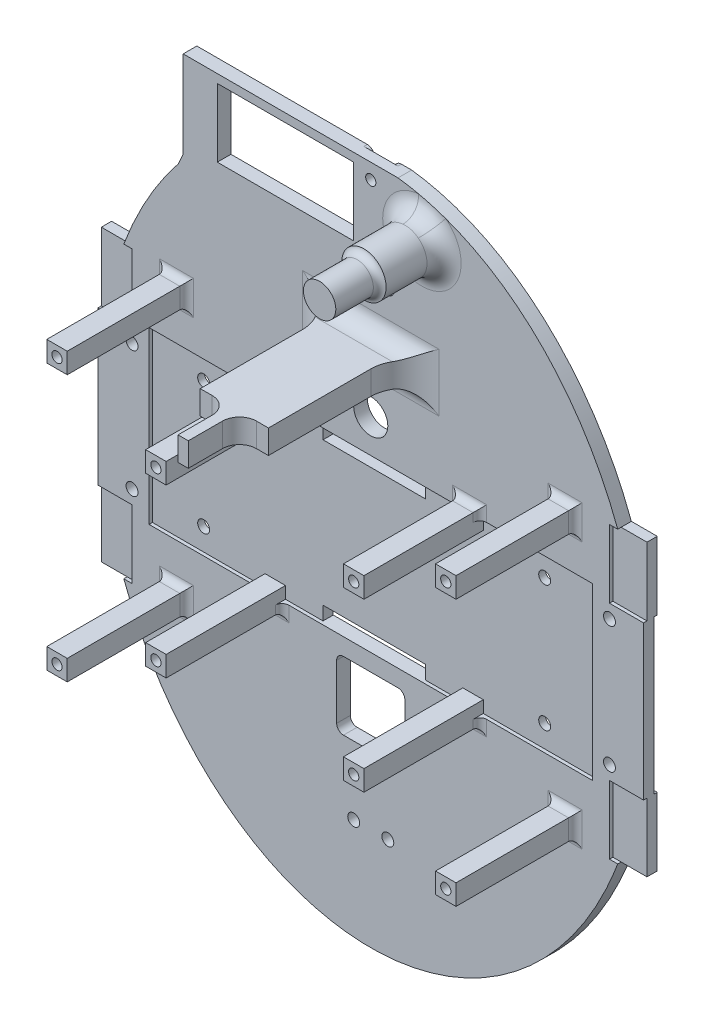
from build123d import *

# Parameters (mm, degrees)
ESQUISSE1_RX             = 100
ESQUISSE1_RY             = 80
BOSS_EXTRU_1_DEPTH       = 4
ESQUISSE2_W              = 40
ESQUISSE2_H              = 45
BOSS_EXTRU_2_DEPTH       = 4
ENL_V_MAT_EXTRU_1_DEPTH  = 1
ESQUISSE4_W              = 20
ESQUISSE4_H              = 20
ENL_V_MAT_EXTRU_2_DEPTH  = 129.124939168
CONG_1_R                 = 2
BOSS_EXTRU_4_START       = -4
BOSS_EXTRU_4_OUTLINE_W   = 40
BOSS_EXTRU_4_OUTLINE_H   = 45
BOSS_EXTRU_4_DEPTH       = 4
ESQUISSE6_W              = 40
ESQUISSE6_H              = 20
ENL_V_MAT_EXTRU_3_DEPTH  = 129.124939168
ESQUISSE7_R              = 6.5
BOSS_EXTRU_5_DEPTH       = 17
CONG_3_R                 = 5
ESQUISSE8_R              = 4.75
BOSS_EXTRU_6_DEPTH       = 13
CONG_4_R                 = 2
ESQUISSE9_W              = 50
ESQUISSE9_H              = 50
ESQUISSE9_R              = 2.5
ENL_V_MAT_EXTRU_5_DEPTH  = 1
ESQUISSE10_W             = 130
ESQUISSE10_H             = 50
ENL_V_MAT_EXTRU_6_DEPTH  = 1
ESQUISSE12_R             = 1.75
ENL_V_MAT_EXTRU_8_DEPTH  = 133.499056736
ESQUISSE13_W             = 20
ESQUISSE13_H             = 7
BOSS_EXTRU_7_DEPTH       = 40
CONG_5_R                 = 10
CONG_6_R                 = 5
ESQUISSE14_W             = 3
ESQUISSE14_H             = 7
BOSS_EXTRU_8_DEPTH       = 15
CONG_7_R                 = 5
BOSS_EXTRU_9_DEPTH       = 4
ESQUISSE16_R             = 5
ENL_V_MAT_EXTRU_9_DEPTH  = 140.373598719
ESQUISSE17_W             = 10
ESQUISSE17_H             = 20
ENL_V_MAT_EXTRU_10_DEPTH = 1
ESQUISSE27_W             = 40
ESQUISSE27_H             = 45
ENL_V_MAT_EXTRU_18_DEPTH = 1
ENL_V_START              = 50
ESQUISSE18_R             = 1.75
ENL_V_MAT_EXTRU_11_DEPTH = 191.584494237
ESQUISSE19_W             = 30
ESQUISSE19_H             = 4
ENL_V_MAT_EXTRU_12_DEPTH = 140.771241749
BOSS_EXTRU_10_START      = -1
ESQUISSE20_W             = 6
ESQUISSE20_H             = 6
ESQUISSE20_R             = 1.5
BOSS_EXTRU_10_DEPTH      = 35
ESQUISSE21_R             = 1.5
ENL_V_MAT_EXTRU_13_DEPTH = 5
CONG_8_R                 = 2
ESQUISSE20_3_W           = 6
ESQUISSE20_3_H           = 6
ESQUISSE20_3_R           = 1.5
BOSS_EXTRU_11_DEPTH      = 35
ESQUISSE22_R             = 1.5
ENL_V_MAT_EXTRU_14_DEPTH = 5
CONG_9_R                 = 2
ENL_V_START_2            = -3
ESQUISSE23_W             = 6
ESQUISSE23_H             = 8
ENL_V_MAT_EXTRU_15_DEPTH = 1
ESQUISSE24_R             = 1.5
ENL_V_MAT_EXTRU_16_DEPTH = 140.373598719
ENL_V_MAT_EXTRU_17_DEPTH = 140.373598719
CONG_12_R                = 2


# Read off the part's stored shape, not the designer's step: Boss.-Extru.4
with BuildPart() as part:
    # Esquisse1 → Boss.-Extru.1 (new body)
    with BuildSketch(Plane.XY):
        with Locations(Location((0, 0), (0, 0, -90))):
            Ellipse(ESQUISSE1_RX, ESQUISSE1_RY)
    extrude(amount=BOSS_EXTRU_1_DEPTH)

    # Esquisse2 → Boss.-Extru.2 (add)
    with BuildSketch(Plane(origin=(0, 0, 0), x_dir=(-1, 0, 0), z_dir=(0, 0, -1))):
        with Locations((-60, 0)):
            Rectangle(ESQUISSE2_W, ESQUISSE2_H)
        with Locations((60, 0)):
            Rectangle(ESQUISSE2_W, ESQUISSE2_H)
    extrude(amount=-BOSS_EXTRU_2_DEPTH)

    # Esquisse3 → Enlèv. mat.-Extru.1 (cut)
    with BuildSketch(Plane(origin=(0, 0, 0), x_dir=(-1, 0, 0), z_dir=(0, 0, -1))):
        Polygon((-77.94870108, 22.5), (-80, 22.5), (-80, -22.5), (-77.94870108, -22.5), (-40, -22.5), (-40, 22.5), align=None)
        Polygon((77.94870108, 22.5), (40, 22.5), (40, -22.5), (77.94870108, -22.5), (80, -22.5), (80, 22.5), align=None)
    extrude(amount=-ENL_V_MAT_EXTRU_1_DEPTH, mode=Mode.SUBTRACT)

    # Esquisse4 → Enlèv. mat.-Extru.2 (cut, through all)
    with BuildSketch(Plane(origin=(0, 0, 0), x_dir=(-1, 0, 0), z_dir=(0, 0, -1))):
        with Locations((0, -40)):
            Rectangle(ESQUISSE4_W, ESQUISSE4_H)
    extrude(amount=-ENL_V_MAT_EXTRU_2_DEPTH, mode=Mode.SUBTRACT)

    # Congé1
    cong_1_edges = [part.edges().sort_by_distance(p)[0] for p in [
        (-10, -50, 2),
        (10, -50, 2),
        (10, -30, 2),
        (-10, -30, 2),
    ]]
    fillet(cong_1_edges, radius=CONG_1_R)

    # Boss.-Extru.4 outline → Boss.-Extru.4 (add)
    with BuildSketch(Plane.XY.offset(4).offset(BOSS_EXTRU_4_START)):
        with Locations((60, 0)):
            Rectangle(BOSS_EXTRU_4_OUTLINE_W, BOSS_EXTRU_4_OUTLINE_H)
        with Locations((-60, 0)):
            Rectangle(BOSS_EXTRU_4_OUTLINE_W, BOSS_EXTRU_4_OUTLINE_H)
        with BuildLine():
            add(Edge.make_bspline(
                [(-7.989993742, 99.5), (-13.792084078, 98.772005881), (-19.44839325, 97)],
                knots=[3.24781181, 3.24781181, 3.24781181, 3.39699249, 3.39699249, 3.39699249], degree=2, weights=[0.968352937, 0.948036722, 0.933078023]))
            Line((-7.989993742, 99.5), (-55, 99.5))
            Line((-55, 99.5), (-55, 74))
            Line((-55, 74), (-56.337661304, 70.998106475))
            add(Edge.make_bspline(
                [(-45, 82.679728471), (-51.099739487, 77.492387624), (-56.337661304, 70.998106475)],
                knots=[3.741790933, 3.741790933, 3.741790933, 3.918875467, 3.918875467, 3.918875467], degree=2, weights=[0.892550465, 0.889492659, 0.89398403]))
            Line((-45, 82.679728471), (-45, 97))
            Line((-45, 97), (-19.44839325, 97))
        make_face()
    extrude(amount=BOSS_EXTRU_4_DEPTH)

    # Esquisse6 → Enlèv. mat.-Extru.3 (cut, through all)
    with BuildSketch(Plane.XY.offset(4)):
        with Locations((-25, 87)):
            Rectangle(ESQUISSE6_W, ESQUISSE6_H)
    extrude(amount=-ENL_V_MAT_EXTRU_3_DEPTH, mode=Mode.SUBTRACT)

    # Esquisse7 → Boss.-Extru.5 (add)
    with BuildSketch(Plane.XY.offset(4)):
        with Locations((15, 87)):
            Circle(ESQUISSE7_R)
    extrude(amount=BOSS_EXTRU_5_DEPTH)

    # Congé3
    cong_3_edges = [part.edges().sort_by_distance(p)[0] for p in [
        (8.5, 87, 4),
    ]]
    fillet(cong_3_edges, radius=CONG_3_R)

    # Esquisse8 → Boss.-Extru.6 (add)
    with BuildSketch(Plane.XY.offset(21)):
        with Locations(Location((15, 87, 0), (0, 0, 180))):
            Circle(ESQUISSE8_R)
    extrude(amount=BOSS_EXTRU_6_DEPTH)

    # Congé4
    # the kernel refuses this fillet: 2 mm, written as the material it adds along each edge
    with BuildSketch(Plane(origin=(15, 87, 21), x_dir=(-1, 0, 0), z_dir=(0, 1, 0))) as cong_4_piece_1:
        with BuildLine():
            CenterArc((6.75, 1.984313483), CONG_4_R, 180, 82.819244219)
            Line((4.75, 1.984313483), (4.71, 1.984313483))
            Line((4.71, 1.984313483), (4.71, 0))
            Line((4.71, 0), (4.75, -0.04))
            ThreePointArc((4.75, -0.04), (5.625, -0.04), (6.495, -0.03968627))
            Line((6.495, -0.03968627), (6.5, 0))
        make_face()
    revolve(axis=Axis((15, 87, 21), (0, 0, 1)))

    # Esquisse9 → Enlèv. mat.-Extru.5 (cut)
    with BuildSketch(Plane.XY.offset(4)):
        Rectangle(ESQUISSE9_W, ESQUISSE9_H)
        with Locations((-17, 17)):
            Circle(ESQUISSE9_R, mode=Mode.SUBTRACT)
        with Locations((17, 17)):
            Circle(ESQUISSE9_R, mode=Mode.SUBTRACT)
        with Locations((17, -17)):
            Circle(ESQUISSE9_R, mode=Mode.SUBTRACT)
        with Locations((-17, -17)):
            Circle(ESQUISSE9_R, mode=Mode.SUBTRACT)
    extrude(amount=-ENL_V_MAT_EXTRU_5_DEPTH, mode=Mode.SUBTRACT)

    # Esquisse10 → Enlèv. mat.-Extru.6 (cut)
    with BuildSketch(Plane.XY.offset(4)):
        Rectangle(ESQUISSE10_W, ESQUISSE10_H)
    extrude(amount=-ENL_V_MAT_EXTRU_6_DEPTH, mode=Mode.SUBTRACT)

    # Esquisse12 → Enlèv. mat.-Extru.8 (cut, through all)
    with BuildSketch(Plane(origin=(0, 0, 0), x_dir=(-1, 0, 0), z_dir=(0, 0, -1))):
        with Locations((-5, 70)):
            Circle(ESQUISSE12_R)
        with Locations((5, 70)):
            Circle(ESQUISSE12_R)
        with Locations((-5, -70)):
            Circle(ESQUISSE12_R)
        with Locations((5, -70)):
            Circle(ESQUISSE12_R)
    extrude(amount=-ENL_V_MAT_EXTRU_8_DEPTH, mode=Mode.SUBTRACT)

    # Esquisse13 → Boss.-Extru.7 (add)
    with BuildSketch(Plane.XY.offset(4)):
        with Locations((0, 53.5)):
            Rectangle(ESQUISSE13_W, ESQUISSE13_H)
    extrude(amount=BOSS_EXTRU_7_DEPTH)

    # Congé5
    cong_5_edges = [part.edges().sort_by_distance(p)[0] for p in [
        (-10, 53.5, 4),
        (10, 53.5, 4),
    ]]
    fillet(cong_5_edges, radius=CONG_5_R)

    # Congé6
    cong_6_edges = [part.edges().sort_by_distance(p)[0] for p in [
        (0, 50, 4),
        (0, 57, 4),
    ]]
    fillet(cong_6_edges, radius=CONG_6_R)

    # Esquisse14 → Boss.-Extru.8 (add)
    with BuildSketch(Plane.XY.offset(44)):
        with Locations((0, 53.5)):
            Rectangle(ESQUISSE14_W, ESQUISSE14_H)
    extrude(amount=BOSS_EXTRU_8_DEPTH)

    # Congé7
    cong_7_edges = [part.edges().sort_by_distance(p)[0] for p in [
        (-1.5, 53.5, 44),
        (1.5, 53.5, 44),
    ]]
    fillet(cong_7_edges, radius=CONG_7_R)

    # Esquisse15 → Boss.-Extru.9 (add)
    with BuildSketch(Plane.XY.offset(4)):
        with BuildLine():
            Line((-80, 42.5), (-80, 22.5))
            Line((-80, 22.5), (-77.94870108, 22.5))
            add(Edge.make_bspline(
                [(-72.415467961, 42.5), (-76.033351154, 32.867988807), (-77.94870108, 22.5)],
                knots=[4.272997494, 4.272997494, 4.272997494, 4.485445944, 4.485445944, 4.485445944], degree=2, weights=[0.981528774, 0.98515969, 1]))
            Line((-72.415467961, 42.5), (-80, 42.5))
        make_face()
        with BuildLine():
            Line((-77.94870108, -22.5), (-80, -22.5))
            Line((-80, -22.5), (-80, -42.5))
            Line((-80, -42.5), (-72.415467961, -42.5))
            add(Edge.make_bspline(
                [(-77.94870108, -22.5), (-76.033351154, -32.867988807), (-72.415467961, -42.5)],
                knots=[4.939332017, 4.939332017, 4.939332017, 5.160818245, 5.160818245, 5.160818245], degree=2, weights=[1, 0.964173294, 0.940156095]))
        make_face()
        with BuildLine():
            add(Edge.make_bspline(
                [(72.415467961, -42.5), (76.033351154, -32.867988807), (77.94870108, -22.5)],
                knots=[1.122367062, 1.122367062, 1.122367062, 1.343853291, 1.343853291, 1.343853291], degree=2, weights=[0.940156095, 0.964173294, 1]))
            Line((72.415467961, -42.5), (80, -42.5))
            Line((80, -42.5), (80, -22.5))
            Line((80, -22.5), (77.94870108, -22.5))
        make_face()
        with BuildLine():
            Line((77.94870108, 22.5), (80, 22.5))
            Line((80, 22.5), (80, 42.5))
            Line((80, 42.5), (72.415467961, 42.5))
            add(Edge.make_bspline(
                [(77.94870108, 22.5), (76.033351154, 32.867988807), (72.415467961, 42.5)],
                knots=[1.797739363, 1.797739363, 1.797739363, 2.014673873, 2.014673873, 2.014673873], degree=2, weights=[1, 0.971773551, 0.955036388]))
        make_face()
    extrude(amount=-BOSS_EXTRU_9_DEPTH)

    # Esquisse16 → Enlèv. mat.-Extru.9 (cut, through all)
    with BuildSketch(Plane.XY.offset(4)):
        with Locations((0, 35)):
            Circle(ESQUISSE16_R)
    extrude(amount=-ENL_V_MAT_EXTRU_9_DEPTH, mode=Mode.SUBTRACT)

    # Esquisse17 → Enlèv. mat.-Extru.10 (cut)
    with BuildSketch(Plane.XY.offset(4)):
        with Locations((-75, 32.5)):
            Rectangle(ESQUISSE17_W, ESQUISSE17_H)
        with Locations((75, 32.5)):
            Rectangle(ESQUISSE17_W, ESQUISSE17_H)
        with Locations((75, -32.5)):
            Rectangle(ESQUISSE17_W, ESQUISSE17_H)
        with Locations((-75, -32.5)):
            Rectangle(ESQUISSE17_W, ESQUISSE17_H)
    extrude(amount=-ENL_V_MAT_EXTRU_10_DEPTH, mode=Mode.SUBTRACT)

    # Esquisse27 → Enlèv. mat.-Extru.18 (cut)
    with BuildSketch(Plane(origin=(0, 0, 0), x_dir=(-1, 0, 0), z_dir=(0, 0, -1))):
        with Locations((-60, 0)):
            Rectangle(ESQUISSE27_W, ESQUISSE27_H)
        with Locations((60, 0)):
            Rectangle(ESQUISSE27_W, ESQUISSE27_H)
    extrude(amount=-ENL_V_MAT_EXTRU_18_DEPTH, mode=Mode.SUBTRACT)

    # Esquisse18 → Enlèv. mat.-Extru.11 (cut, through all)
    with BuildSketch(Plane(origin=(0, 0, 1), x_dir=(-1, 0, 0), z_dir=(0, 0, -1)).offset(ENL_V_START)):
        with Locations((-70, 18.5)):
            Circle(ESQUISSE18_R)
        with Locations((-50, 18.5)):
            Circle(ESQUISSE18_R)
        with Locations((-70, -18.5)):
            Circle(ESQUISSE18_R)
        with Locations((-50, -18.5)):
            Circle(ESQUISSE18_R)
        with Locations((50, 18.5)):
            Circle(ESQUISSE18_R)
        with Locations((70, 18.5)):
            Circle(ESQUISSE18_R)
        with Locations((70, -18.5)):
            Circle(ESQUISSE18_R)
        with Locations((50, -18.5)):
            Circle(ESQUISSE18_R)
    extrude(amount=-ENL_V_MAT_EXTRU_11_DEPTH, mode=Mode.SUBTRACT)

    # Esquisse19 → Enlèv. mat.-Extru.12 (cut, through all)
    with BuildSketch(Plane.XY.offset(3)):
        with Locations((0, 23)):
            Rectangle(ESQUISSE19_W, ESQUISSE19_H)
        with Locations((0, -23)):
            Rectangle(ESQUISSE19_W, ESQUISSE19_H)
    extrude(amount=-ENL_V_MAT_EXTRU_12_DEPTH, mode=Mode.SUBTRACT)

    # Esquisse20 → Boss.-Extru.10 (add)
    # profile 1 of 8: a face of its own
    with BuildSketch(Plane.XY.offset(4).offset(BOSS_EXTRU_10_START)):
        with Locations((-29, 24.5)):
            Rectangle(ESQUISSE20_W, ESQUISSE20_H)
        with Locations((-29, 24.5)):
            Circle(ESQUISSE20_R, mode=Mode.SUBTRACT)
    # profile 2 of 8: a face of its own
    with BuildSketch(Plane.XY.offset(4).offset(BOSS_EXTRU_10_START)):
        with Locations((29, 24.5)):
            Rectangle(ESQUISSE20_W, ESQUISSE20_H)
        with Locations((29, 24.5)):
            Circle(ESQUISSE20_R, mode=Mode.SUBTRACT)
    # profile 3 of 8: a face of its own
    with BuildSketch(Plane.XY.offset(4).offset(BOSS_EXTRU_10_START)):
        with Locations((-29, 24.5)):
            Circle(ESQUISSE20_R)
    # profile 4 of 8: a face of its own
    with BuildSketch(Plane.XY.offset(4).offset(BOSS_EXTRU_10_START)):
        with Locations((29, 24.5)):
            Circle(ESQUISSE20_R)
    # profile 5 of 8: a face of its own
    with BuildSketch(Plane.XY.offset(4).offset(BOSS_EXTRU_10_START)):
        with Locations((29, -24.5)):
            Rectangle(ESQUISSE20_W, ESQUISSE20_H)
        with Locations((29, -24.5)):
            Circle(ESQUISSE20_R, mode=Mode.SUBTRACT)
    # profile 6 of 8: a face of its own
    with BuildSketch(Plane.XY.offset(4).offset(BOSS_EXTRU_10_START)):
        with Locations((29, -24.5)):
            Circle(ESQUISSE20_R)
    # profile 7 of 8: a face of its own
    with BuildSketch(Plane.XY.offset(4).offset(BOSS_EXTRU_10_START)):
        with Locations((-29, -24.5)):
            Rectangle(ESQUISSE20_W, ESQUISSE20_H)
        with Locations((-29, -24.5)):
            Circle(ESQUISSE20_R, mode=Mode.SUBTRACT)
    # profile 8 of 8: a face of its own
    with BuildSketch(Plane.XY.offset(4).offset(BOSS_EXTRU_10_START)):
        with Locations((-29, -24.5)):
            Circle(ESQUISSE20_R)
    extrude(amount=BOSS_EXTRU_10_DEPTH)

    # Esquisse21 → Enlèv. mat.-Extru.13 (cut)
    with BuildSketch(Plane.XY.offset(38)):
        with Locations((29, -24.5)):
            Circle(ESQUISSE21_R)
        with Locations(Location((-29, 24.5, 0), (0, 0, 180))):
            Circle(ESQUISSE21_R)
        with Locations((29, 24.5)):
            Circle(ESQUISSE21_R)
        with Locations((-29, -24.5)):
            Circle(ESQUISSE21_R)
    extrude(amount=-ENL_V_MAT_EXTRU_13_DEPTH, mode=Mode.SUBTRACT)

    # Congé8
    cong_8_edges = [part.edges().sort_by_distance(p)[0] for p in [
        (-29, 27.5, 4),
        (-32, 26.25, 4),
        (-26, 26.25, 4),
        (29, 27.5, 4),
        (26, 26.25, 4),
        (32, 26.25, 4),
        (29, -27.5, 4),
        (32, -26.25, 4),
        (26, -26.25, 4),
        (-29, -27.5, 4),
        (-26, -26.25, 4),
        (-32, -26.25, 4),
    ]]
    fillet(cong_8_edges, radius=CONG_8_R)

    # Esquisse20<3> → Boss.-Extru.11 (add)
    # profile 1 of 8: a face of its own
    with BuildSketch(Plane.XY.offset(4)):
        with Locations((57, -39)):
            Rectangle(ESQUISSE20_3_W, ESQUISSE20_3_H)
        with Locations((57, -39)):
            Circle(ESQUISSE20_3_R, mode=Mode.SUBTRACT)
    # profile 2 of 8: a face of its own
    with BuildSketch(Plane.XY.offset(4)):
        with Locations((57, -39)):
            Circle(ESQUISSE20_3_R)
    # profile 3 of 8: a face of its own
    with BuildSketch(Plane.XY.offset(4)):
        with Locations((-57, -39)):
            Rectangle(ESQUISSE20_3_W, ESQUISSE20_3_H)
        with Locations((-57, -39)):
            Circle(ESQUISSE20_3_R, mode=Mode.SUBTRACT)
    # profile 4 of 8: a face of its own
    with BuildSketch(Plane.XY.offset(4)):
        with Locations((-57, -39)):
            Circle(ESQUISSE20_3_R)
    # profile 5 of 8: a face of its own
    with BuildSketch(Plane.XY.offset(4)):
        with Locations((-57, 39)):
            Rectangle(ESQUISSE20_3_W, ESQUISSE20_3_H)
        with Locations((-57, 39)):
            Circle(ESQUISSE20_3_R, mode=Mode.SUBTRACT)
    # profile 6 of 8: a face of its own
    with BuildSketch(Plane.XY.offset(4)):
        with Locations((-57, 39)):
            Circle(ESQUISSE20_3_R)
    # profile 7 of 8: a face of its own
    with BuildSketch(Plane.XY.offset(4)):
        with Locations((57, 39)):
            Rectangle(ESQUISSE20_3_W, ESQUISSE20_3_H)
        with Locations((57, 39)):
            Circle(ESQUISSE20_3_R, mode=Mode.SUBTRACT)
    # profile 8 of 8: a face of its own
    with BuildSketch(Plane.XY.offset(4)):
        with Locations((57, 39)):
            Circle(ESQUISSE20_3_R)
    extrude(amount=BOSS_EXTRU_11_DEPTH)

    # Esquisse22 → Enlèv. mat.-Extru.14 (cut)
    with BuildSketch(Plane.XY.offset(39)):
        with Locations((-57, 39)):
            Circle(ESQUISSE22_R)
        with Locations((-57, -39)):
            Circle(ESQUISSE22_R)
        with Locations((57, 39)):
            Circle(ESQUISSE22_R)
        with Locations((57, -39)):
            Circle(ESQUISSE22_R)
    extrude(amount=-ENL_V_MAT_EXTRU_14_DEPTH, mode=Mode.SUBTRACT)

    # Congé9
    cong_9_edges = [part.edges().sort_by_distance(p)[0] for p in [
        (60, -39, 4),
        (57, -36, 4),
        (54, -39, 4),
        (57, -42, 4),
        (-57, -42, 4),
        (-54, -39, 4),
        (-60, -39, 4),
        (-57, -36, 4),
        (-60, 39, 4),
        (-57, 36, 4),
        (-54, 39, 4),
        (-57, 42, 4),
        (57, 42, 4),
        (54, 39, 4),
        (60, 39, 4),
        (57, 36, 4),
    ]]
    fillet(cong_9_edges, radius=CONG_9_R)

    # Esquisse23 → Enlèv. mat.-Extru.15 (cut)
    with BuildSketch(Plane.XY.offset(4).offset(ENL_V_START_2)):
        with Locations((0, 96)):
            Rectangle(ESQUISSE23_W, ESQUISSE23_H)
    extrude(amount=-ENL_V_MAT_EXTRU_15_DEPTH, mode=Mode.SUBTRACT)

    # Esquisse24 → Enlèv. mat.-Extru.16 (cut, through all)
    with BuildSketch(Plane.XY.offset(4)):
        with Locations((0, 95)):
            Circle(ESQUISSE24_R)
    extrude(amount=-ENL_V_MAT_EXTRU_16_DEPTH, mode=Mode.SUBTRACT)

    # Esquisse26 → Enlèv. mat.-Extru.17 (cut, through all)
    with BuildSketch(Plane.XY.offset(4)):
        Polygon((-7.989993742, 99.5), (9.213160672, 99.5), (9.213160672, 102.165907484), align=None)
    extrude(amount=-ENL_V_MAT_EXTRU_17_DEPTH, mode=Mode.SUBTRACT)

    # Congé12
    cong_12_edges = [part.edges().sort_by_distance(p)[0] for p in [
        (3, 99.5, 0.5),
        (-3, 99.5, 0.5),
    ]]
    fillet(cong_12_edges, radius=CONG_12_R)


solid = part.part
